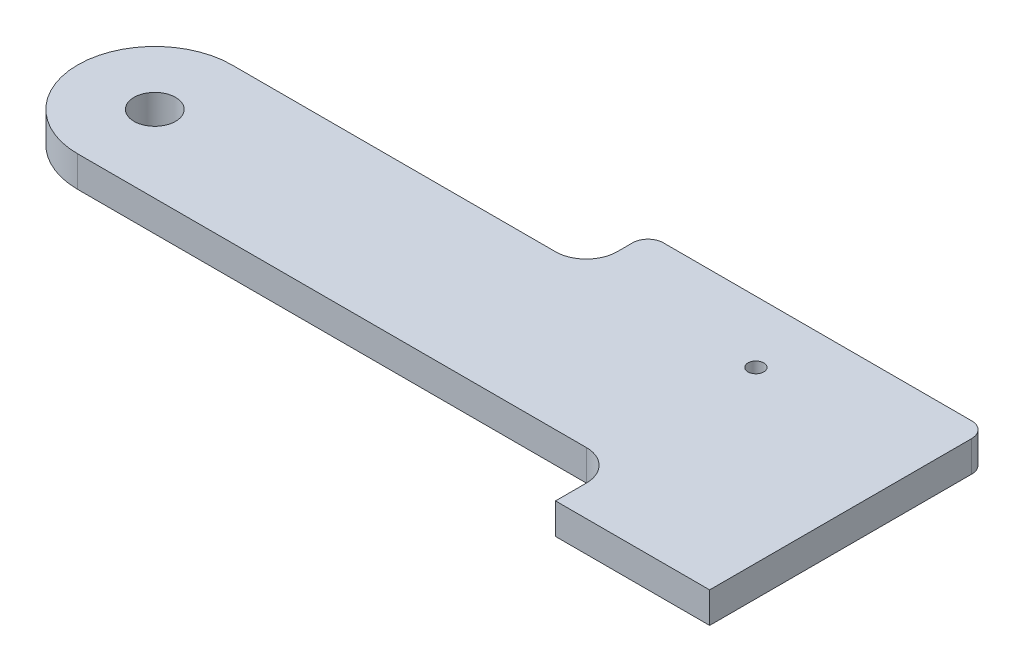
from build123d import *

# Parameters (mm, degrees)
SKETCH1_W           = 250
SKETCH1_H           = 50
BOSS_EXTRUDE1_DEPTH = 10
FILLET2_R           = 25
SKETCH4_R           = 6.75
CUT_EXTRUDE3_DEPTH  = 128.867118525
SKETCH5_W           = 110
SKETCH5_H           = 10
BOSS_EXTRUDE2_DEPTH = 20
SKETCH6_W           = 50
SKETCH6_H           = 10
BOSS_EXTRUDE3_DEPTH = 20
FILLET3_R           = 10
FILLET4_R           = 5
SKETCH7_R           = 2.5527
CUT_EXTRUDE4_DEPTH  = 134.229125945


with BuildPart() as part:
    # Sketch1 → Boss-Extrude1 (new body)
    with BuildSketch(Plane(origin=(0, 0, 0), x_dir=(1, 0, 0), z_dir=(0, 1, 0))):
        Rectangle(SKETCH1_W, SKETCH1_H)
    extrude(amount=BOSS_EXTRUDE1_DEPTH)

    # Fillet2
    fillet2_edges = [part.edges().sort_by_distance(p)[0] for p in [
        (-125, 5, 25),
        (-125, 5, -25),
    ]]
    fillet(fillet2_edges, radius=FILLET2_R - 0.0001)  # a hair under: the kernel refuses the full size

    # Sketch4 → Cut-Extrude3 (cut, through all)
    with BuildSketch(Plane(origin=(0, 10, 0), x_dir=(1, 0, 0), z_dir=(0, 1, 0))):
        with Locations(Location((-100, 0, 0), (0, 0, 270))):
            Circle(SKETCH4_R)
    extrude(amount=-CUT_EXTRUDE3_DEPTH, mode=Mode.SUBTRACT)

    # Sketch5 → Boss-Extrude2 (add)
    with BuildSketch(Plane(origin=(0, 0, -25), x_dir=(-1, 0, 0), z_dir=(0, 0, -1))):
        with Locations((-70, 5)):
            Rectangle(SKETCH5_W, SKETCH5_H)
    extrude(amount=BOSS_EXTRUDE2_DEPTH)

    # Sketch6 → Boss-Extrude3 (add)
    with BuildSketch(Plane.XY.offset(25)):
        with Locations((100, 5)):
            Rectangle(SKETCH6_W, SKETCH6_H)
    extrude(amount=BOSS_EXTRUDE3_DEPTH)

    # Fillet3
    fillet3_edges = [part.edges().sort_by_distance(p)[0] for p in [
        (15, 5, -25),
        (75, 5, 25),
    ]]
    fillet(fillet3_edges, radius=FILLET3_R)

    # Fillet4
    fillet4_edges = [part.edges().sort_by_distance(p)[0] for p in [
        (125, 5, -45),
        (15, 5, -45),
    ]]
    fillet(fillet4_edges, radius=FILLET4_R)

    # Sketch7 → Cut-Extrude4 (cut, through all)
    with BuildSketch(Plane.XZ):
        with Locations(Location((70, -25, 0), (0, 0, 270))):
            Circle(SKETCH7_R)
    extrude(amount=-CUT_EXTRUDE4_DEPTH, mode=Mode.SUBTRACT)


solid = part.part
